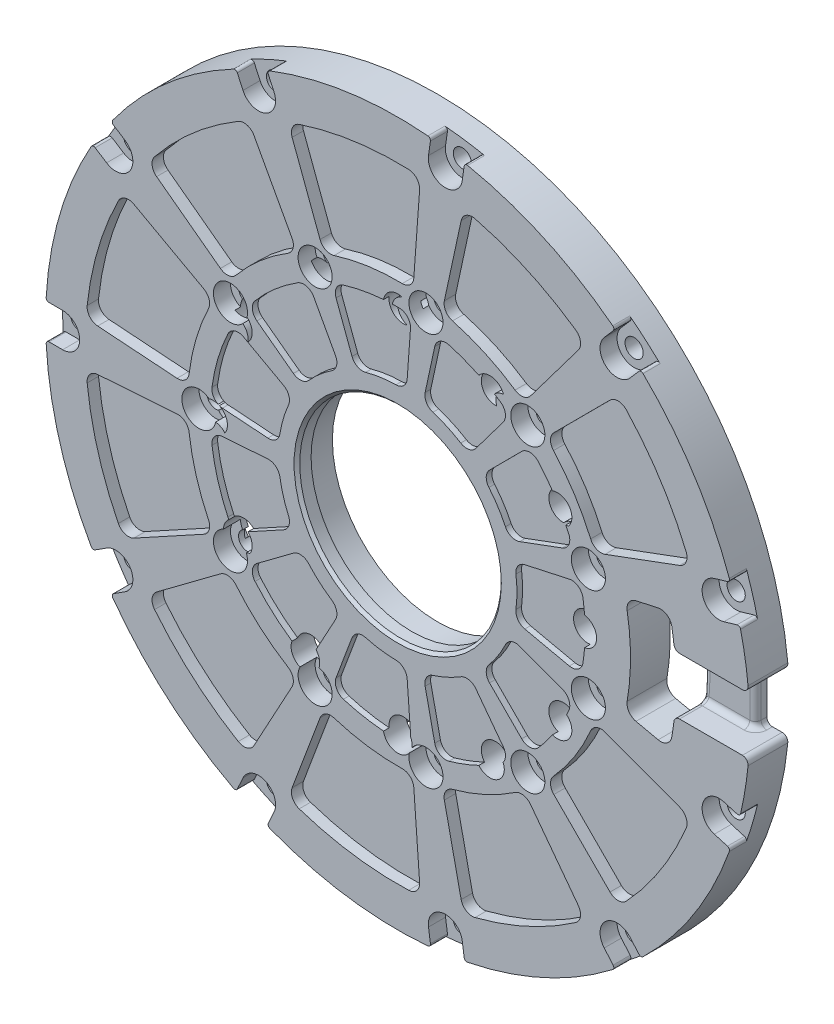
from build123d import *

# Parameters (mm, degrees)
SKETCH1_R           = 39.1
SKETCH1_R_2         = 2.5250000000000004
SKETCH1_R_3         = 2.524999999999999
SKETCH1_R_4         = 2.524999999999997
SKETCH1_R_5         = 2.5250000000000044
SKETCH1_R_6         = 2.525000000000001
SKETCH1_R_7         = 16
BOSS_EXTRUDE1_DEPTH = 7
SKETCH2_R           = 18.5
CUT_EXTRUDE1_DEPTH  = 4.5
SKETCH3_R           = 2.5500000000000007
SKETCH3_R_2         = 2.549999999999998
SKETCH3_R_3         = 2.5499999999999994
SKETCH3_R_4         = 2.5500000000000025
SKETCH3_R_5         = 2.549999999999999
SKETCH3_R_6         = 2.549999999999996
SKETCH3_R_7         = 2.55
BOSS_EXTRUDE2_DEPTH = 2
CHAMFER3_SIZE       = 0.5
SKETCH4_R           = 39.1
CUT_EXTRUDE2_DEPTH  = 3
SKETCH5_R           = 17.75
CUT_EXTRUDE3_DEPTH  = 10
CHAMFER5_SIZE       = 0.5
SKETCH7_R           = 1.5749999999999995
SKETCH7_R_2         = 1.5750000000000013
SKETCH7_R_3         = 1.574999999999998
SKETCH7_R_4         = 1.5749999999999964
SKETCH7_R_5         = 1.5750000000000004
CUT_EXTRUDE5_DEPTH  = 56.737061291388535
BOSS_EXTRUDE3_START = -7
SKETCH8_R           = 62
SKETCH8_R_2         = 39.1
BOSS_EXTRUDE3_DEPTH = 7
SKETCH9_R           = 40
SKETCH9_R_2         = 39.1
CUT_EXTRUDE6_DEPTH  = 3
SKETCH11_R          = 1.599999999999998
SKETCH11_R_2        = 1.5999999999999976
SKETCH11_R_3        = 1.5999999999999988
SKETCH11_R_4        = 1.5999999999999983
SKETCH11_R_5        = 1.5999999999999994
SKETCH11_R_6        = 1.5999999999999959
SKETCH11_R_7        = 1.5999999999999925
SKETCH11_R_8        = 1.6000000000000039
SKETCH11_R_9        = 1.6000000000000043
CUT_EXTRUDE7_DEPTH  = 88.96021828872415
CUT_EXTRUDE9_DEPTH  = 1
CUT_EXTRUDE10_DEPTH = 2
CUT_EXTRUDE11_DEPTH = 88.96021828872415
SKETCH15_W          = 13.794781450302672
SKETCH15_H          = 10
CUT_EXTRUDE14_DEPTH = 5
CUT_EXTRUDE15_DEPTH = 88.96021828872415
FILLET3_R           = 1
CUT_EXTRUDE16_DEPTH = 3
FILLET4_R           = 0.5
SKETCH18_R          = 3.0000000000000013
SKETCH18_R_2        = 3.000000000000005
SKETCH18_R_3        = 3.0000000000000018
SKETCH18_R_4        = 3.0000000000000036
SKETCH18_R_5        = 2.999999999999994
SKETCH18_R_6        = 3.000000000000004
SKETCH18_R_7        = 2.999999999999999
CUT_EXTRUDE17_DEPTH = 3


with BuildPart() as part:
    # Sketch1 → Boss-Extrude1 (new body)
    with BuildSketch(Plane.XY.offset(15)):
        Circle(SKETCH1_R)
        with Locations((32.5, 0)):
            Circle(SKETCH1_R_2, mode=Mode.SUBTRACT)
        with Locations((28.145825622994256, -16.249999999999996)):
            Circle(SKETCH1_R_2, mode=Mode.SUBTRACT)
        with Locations((16.250000000000004, -28.145825622994252)):
            Circle(SKETCH1_R_2, mode=Mode.SUBTRACT)
        with Locations((1.99e-15, -32.5)):
            Circle(SKETCH1_R_3, mode=Mode.SUBTRACT)
        with Locations((-16.249999999999993, -28.14582562299426)):
            Circle(SKETCH1_R_2, mode=Mode.SUBTRACT)
        with Locations((-28.145825622994252, -16.25000000000001)):
            Circle(SKETCH1_R_4, mode=Mode.SUBTRACT)
        with Locations((-32.5, -3.98e-15)):
            Circle(SKETCH1_R_5, mode=Mode.SUBTRACT)
        with Locations((-28.14582562299426, 16.24999999999999)):
            Circle(SKETCH1_R_2, mode=Mode.SUBTRACT)
        with Locations((-16.250000000000014, 28.145825622994252)):
            Circle(SKETCH1_R_4, mode=Mode.SUBTRACT)
        with Locations((-5.97e-15, 32.5)):
            Circle(SKETCH1_R_6, mode=Mode.SUBTRACT)
        with Locations((16.24999999999998, 28.145825622994266)):
            Circle(SKETCH1_R_4, mode=Mode.SUBTRACT)
        Circle(SKETCH1_R_7, mode=Mode.SUBTRACT)
        with Locations((28.145825622994256, 16.25)):
            Circle(SKETCH1_R_2, mode=Mode.SUBTRACT)
    extrude(amount=BOSS_EXTRUDE1_DEPTH)

    # Sketch2 → Cut-Extrude1 (cut)
    with BuildSketch(Plane(origin=(0, 0, 15), x_dir=(-1, 0, 0), z_dir=(0, 0, -1))):
        Circle(SKETCH2_R)
    extrude(amount=-CUT_EXTRUDE1_DEPTH, mode=Mode.SUBTRACT)

    # Sketch3 → Boss-Extrude2 (add)
    with BuildSketch(Plane.XY.offset(22)):
        with Locations((-16.250000000000014, 28.145825622994252)):
            Circle(SKETCH3_R)
        with Locations((1.5464122642716096, 32.46318852344777)):
            Circle(SKETCH3_R_2)
        with Locations((18.85184956106393, 26.473718441635924)):
            Circle(SKETCH3_R_3)
        with Locations((30.17195782302236, 12.079029808960666)):
            Circle(SKETCH3_R_4)
        with Locations((31.912682661037973, -6.150665441713317)):
            Circle(SKETCH3_R_5)
        with Locations((23.5213562384148, -22.427567873168638)):
            Circle(SKETCH3_R_6)
        with Locations((7.662165404056412, -31.583875970515102)):
            Circle(SKETCH3_R_3)
        with Locations((-10.629708807816185, -30.71252660822673)):
            Circle(SKETCH3_R)
        with Locations((-25.546725579140585, -20.090167052169683)):
            Circle(SKETCH3_R_3)
        with Locations((-32.35283748362525, -3.089321407385964)):
            Circle(SKETCH3_R_3)
        with Locations((-28.887152081285027, 14.892361956140828)):
            Circle(SKETCH3_R_7)
    extrude(amount=-BOSS_EXTRUDE2_DEPTH)

    # Chamfer3
    chamfer3_edges = [part.edges().sort_by_distance(p)[0] for p in [
        (29.975, 3.1e-16, 15),
        (25.620825622994253, -16.249999999999996, 15),
        (13.725000000000003, -28.145825622994252, 15),
        (-2.5249999999999972, -32.5, 15),
        (-18.77499999999999, -28.14582562299426, 15),
        (-30.67082562299425, -16.25000000000001, 15),
        (-35.025000000000006, -3.67e-15, 15),
        (-30.670825622994258, 16.24999999999999, 15),
        (-18.775000000000013, 28.145825622994252, 15),
        (-2.5250000000000066, 32.5, 15),
        (13.724999999999982, 28.145825622994266, 15),
    ]]
    chamfer(chamfer3_edges, length=CHAMFER3_SIZE)

    # Sketch4 → Cut-Extrude2 (cut)
    with BuildSketch(Plane(origin=(0, 0, 15), x_dir=(-1, 0, 0), z_dir=(0, 0, -1))):
        Circle(SKETCH4_R)
        with BuildLine():
            ThreePointArc((-6.4472908855823725, 32.31307692307692), (5.97e-15, 38.949999999999996), (6.447290885582385, 32.31307692307692))
            ThreePointArc((6.4472908855823805, 32.313076923076906), (9.283087747925112, 31.61529348059768), (12.045962087511466, 30.669158732939437))
            ThreePointArc((12.045962087511468, 30.669158732939447), (21.057959839895535, 32.7668251037745), (22.89357455688436, 23.697821503428884))
            ThreePointArc((22.89357455688436, 23.697821503428884), (24.90194847497281, 21.577661183497135), (26.714707210521354, 19.28799934301425))
            ThreePointArc((26.714707210521354, 19.28799934301425), (35.43016621905849, 16.180414756423474), (32.071310064643654, 7.558675197247654))
            ThreePointArc((32.07131006464366, 7.558675197247655), (32.61461650997674, 4.689273921104743), (32.90172155129198, 1.7830364441730298))
            ThreePointArc((32.90172155129197, 1.7830364441730282), (38.553545161262335, -5.5431629507444615), (31.06663123192701, -10.980297077012864))
            ThreePointArc((31.066631231927012, -10.98029707701286), (29.972374246931373, -13.68792467841216), (28.64267177198301, -16.288027927359646))
            ThreePointArc((28.642671771983007, -16.288027927359643), (29.436445921098354, -25.506825587168862), (20.19851648940056, -26.033102612393584))
            ThreePointArc((20.19851648940056, -26.033102612393584), (17.814114935161932, -27.719303906787424), (15.289776084517339, -29.187758517661507))
            ThreePointArc((15.289776084517337, -29.187758517661504), (10.973483088973685, -37.372251322284676), (2.917515477387173, -32.82058200945265))
            ThreePointArc((2.9175154773871737, -32.82058200945265), (-4.4e-16, -32.95), (-2.917515477387175, -32.82058200945265))
            ThreePointArc((-2.9175154773871714, -32.82058200945265), (-10.97348308897368, -37.372251322284676), (-15.289776084517333, -29.187758517661507))
            ThreePointArc((-15.28977608451734, -29.187758517661514), (-17.81411493516194, -27.719303906787424), (-20.198516489400568, -26.033102612393577))
            ThreePointArc((-20.19851648940056, -26.033102612393574), (-29.436445921098365, -25.506825587168862), (-28.64267177198301, -16.288027927359632))
            ThreePointArc((-28.642671771983018, -16.288027927359632), (-29.97237424693138, -13.687924678412156), (-31.066631231927012, -10.980297077012857))
            ThreePointArc((-31.066631231927012, -10.98029707701286), (-38.55354516126232, -5.543162950744453), (-32.90172155129197, 1.7830364441730326))
            ThreePointArc((-32.90172155129198, 1.7830364441730322), (-32.61461650997672, 4.689273921104741), (-32.07131006464364, 7.558675197247652))
            ThreePointArc((-32.07131006464364, 7.558675197247654), (-35.4301662190585, 16.180414756423467), (-26.71470721052136, 19.28799934301425))
            ThreePointArc((-26.714707210521368, 19.28799934301425), (-24.901948474972805, 21.577661183497142), (-22.89357455688436, 23.697821503428905))
            ThreePointArc((-22.89357455688435, 23.6978215034289), (-21.057959839895513, 32.766825103774515), (-12.04596208751145, 30.66915873293946))
            ThreePointArc((-12.045962087511453, 30.669158732939458), (-9.2830877479251, 31.615293480597693), (-6.447290885582371, 32.31307692307692))
        make_face(mode=Mode.SUBTRACT)
    extrude(amount=-CUT_EXTRUDE2_DEPTH, mode=Mode.SUBTRACT)

    # Sketch5 → Cut-Extrude3 (cut)
    with BuildSketch(Plane.XY.offset(22)):
        Circle(SKETCH5_R)
    extrude(amount=-CUT_EXTRUDE3_DEPTH, mode=Mode.SUBTRACT)

    # Chamfer5
    chamfer5_edges = [part.edges().sort_by_distance(p)[0] for p in [
        (-17.75, 2.17e-15, 22),
    ]]
    chamfer(chamfer5_edges, length=CHAMFER5_SIZE)

    # Sketch7 → Cut-Extrude5 (cut, through all)
    with BuildSketch(Plane.XY.offset(22)):
        with Locations((-35, -4.29e-15)):
            Circle(SKETCH7_R)
        with Locations((-29.443873649091348, 18.922428610945914)):
            Circle(SKETCH7_R)
        with Locations((-14.539525455066029, 31.83711983740814)):
            Circle(SKETCH7_R_2)
        with Locations((4.981019339564972, 34.64375046583265)):
            Circle(SKETCH7_R_3)
        with Locations((22.920125688084976, 26.451235102399046)):
            Circle(SKETCH7_R)
        with Locations((33.58225407650742, 9.860639489450046)):
            Circle(SKETCH7_R)
        with Locations((33.58225407650742, -9.860639489450026)):
            Circle(SKETCH7_R)
        with Locations((22.920125688084987, -26.451235102399032)):
            Circle(SKETCH7_R_4)
        with Locations((4.9810193395649875, -34.643750465832646)):
            Circle(SKETCH7_R_5)
        with Locations((-14.539525455066011, -31.837119837408153)):
            Circle(SKETCH7_R)
        with Locations((-29.443873649091337, -18.922428610945925)):
            Circle(SKETCH7_R_4)
    extrude(amount=-CUT_EXTRUDE5_DEPTH, mode=Mode.SUBTRACT)

    # Sketch8 → Boss-Extrude3 (add)
    with BuildSketch(Plane.XY.offset(22).offset(BOSS_EXTRUDE3_START)):
        Circle(SKETCH8_R)
        Circle(SKETCH8_R_2, mode=Mode.SUBTRACT)
    extrude(amount=BOSS_EXTRUDE3_DEPTH)

    # Sketch9 → Cut-Extrude6 (cut)
    with BuildSketch(Plane(origin=(0, 0, 15), x_dir=(-1, 0, 0), z_dir=(0, 0, -1))):
        Circle(SKETCH9_R)
        Circle(SKETCH9_R_2, mode=Mode.SUBTRACT)
    extrude(amount=-CUT_EXTRUDE6_DEPTH, mode=Mode.SUBTRACT)

    # Sketch11 → Cut-Extrude7 (cut, through all)
    with BuildSketch(Plane.XY.offset(22)):
        with Locations((-59, -7.23e-15)):
            Circle(SKETCH11_R)
        with Locations((-49.63395843703966, 31.897808229880315)):
            Circle(SKETCH11_R_2)
        with Locations((-24.509485767111165, 53.66828772591664)):
            Circle(SKETCH11_R_3)
        with Locations((8.39657545812404, 58.399465070975005)):
            Circle(SKETCH11_R_4)
        with Locations((38.63678330277205, 44.58922488690104)):
            Circle(SKETCH11_R_5)
        with Locations((56.610085443255464, 16.622220853643977)):
            Circle(SKETCH11_R_6)
        with Locations((56.6100854432552, -16.622220853644773)):
            Circle(SKETCH11_R_7)
        with Locations((38.63678330277142, -44.58922488690158)):
            Circle(SKETCH11_R_2)
        with Locations((8.39657545812322, -58.39946507097512)):
            Circle(SKETCH11_R_8)
        with Locations((-24.509485767111933, -53.66828772591628)):
            Circle(SKETCH11_R_3)
        with Locations((-49.63395843704012, -31.8978082298796)):
            Circle(SKETCH11_R_9)
    extrude(amount=-CUT_EXTRUDE7_DEPTH, mode=Mode.SUBTRACT)

    # Sketch12 → Cut-Extrude9 (cut)
    with BuildSketch(Plane.XY.offset(22)):
        with BuildLine():
            Line((-22.857063854411898, -1.5983216057281133), (-30.860059476495543, -2.1579455755782355))
            ThreePointArc((-30.860059476495543, -2.1579455755782346), (-32.271527779173944, -2.890355512123229), (-32.70251727281423, -4.42101391326549))
            ThreePointArc((-32.702517272814234, -4.421013913265491), (-31.66326812927847, -9.297174375766968), (-29.90128876427831, -13.961122097999288))
            ThreePointArc((-29.901288764278306, -13.961122097999285), (-28.71118092090148, -15.0157833733615), (-27.127807517987755, -14.868828442987942))
            Line((-27.127807517987755, -14.868828442987942), (-20.09270361714983, -11.012867989464588))
            ThreePointArc((-20.09270361714983, -11.012867989464588), (-19.160316095246387, -9.90247379693526), (-19.223204192706856, -8.453899725304158))
            ThreePointArc((-19.22320419270686, -8.453899725304158), (-20.149352445904487, -5.916383693669891), (-20.742111697625948, -3.2809758187479567))
            ThreePointArc((-20.742111697625948, -3.2809758187479563), (-21.472365133695913, -2.02835789100138), (-22.857063854411898, -1.5983216057281142))
        make_face()
        with BuildLine():
            Line((-20.09270361714969, 11.012867989464858), (-27.127807517987556, 14.868828442988303))
            ThreePointArc((-27.127807517987556, 14.868828442988303), (-28.711180920901278, 15.015783373361879), (-29.901288764278117, 13.961122097999683))
            ThreePointArc((-29.90128876427812, 13.961122097999684), (-31.663268129278354, 9.297174375767387), (-32.70251727281418, 4.421013913265924))
            ThreePointArc((-32.70251727281417, 4.421013913265927), (-32.27152777917391, 2.8903555121236604), (-30.86005947649552, 2.1579455755786467))
            Line((-30.86005947649552, 2.1579455755786467), (-22.85706385441187, 1.5983216057284217))
            ThreePointArc((-22.85706385441187, 1.5983216057284217), (-21.47236513369588, 2.02835789100167), (-20.7421116976259, 3.2809758187482365))
            ThreePointArc((-20.7421116976259, 3.2809758187482374), (-20.149352445904398, 5.9163836936701575), (-19.22320419270674, 8.45389972530441))
            ThreePointArc((-19.22320419270674, 8.45389972530441), (-19.16031609524626, 9.902473796935515), (-20.09270361714969, 11.012867989464858))
        make_face()
        with BuildLine():
            Line((-10.949051949702167, 20.127549811209594), (-14.78266834844707, 27.174854489027556))
            ThreePointArc((-14.78266834844707, 27.174854489027556), (-16.035236983752867, 28.154517134260022), (-17.606612345494316, 27.910700487724903))
            ThreePointArc((-17.606612345494316, 27.910700487724903), (-21.61040422019424, 24.93973595369067), (-25.12092761217698, 21.39950924446082))
            ThreePointArc((-25.12092761217698, 21.39950924446082), (-25.585892587277826, 19.878826944785715), (-24.794460597976695, 18.49958712121385))
            Line((-24.794460597976695, 18.49958712121385), (-18.364467818193926, 13.702055384303454))
            ThreePointArc((-18.364467818193926, 13.702055384303453), (-16.967089958679086, 13.315200280237558), (-15.675545295306671, 13.974164722615408))
            ThreePointArc((-15.675545295306673, 13.97416472261541), (-13.752075412850886, 15.870741061439514), (-11.601065181273494, 17.50472183897373))
            ThreePointArc((-11.601065181273492, 17.50472183897373), (-10.765002076880204, 18.689340021881783), (-10.949051949702167, 20.127549811209594))
        make_face()
        with BuildLine():
            Line((1.670846349471529, 22.85187678236643), (2.2558635723819913, 30.853056243147126))
            ThreePointArc((2.2558635723819904, 30.853056243147126), (1.7317813961666504, 32.35439063534265), (0.2780390906057538, 32.998828680183415))
            ThreePointArc((0.27803909060575366, 32.99882868018342), (-4.696389663018197, 32.66410758207083), (-9.563620930666346, 31.58381159224644))
            ThreePointArc((-9.563620930666344, 31.58381159224644), (-10.776917280199292, 30.55591127955765), (-10.856795668887317, 28.967740467700096))
            Line((-10.856795668887317, 28.967740467700096), (-8.041283006828484, 21.455483392459172))
            ThreePointArc((-8.041283006828484, 21.455483392459172), (-7.074883605510605, 20.374560661207507), (-5.632104019837971, 20.23065506378192))
            ThreePointArc((-5.632104019837972, 20.230655063781924), (-2.9886116037388533, 20.78625027949961), (-0.2956699439955266, 20.997918451223157))
            ThreePointArc((-0.2956699439955265, 20.997918451223153), (1.048124039025304, 21.54247284244696), (1.67084634947153, 22.85187678236643))
        make_face()
        with BuildLine():
            Line((13.760262738324187, 18.320894338767616), (18.57817474815012, 24.735630637345746))
            ThreePointArc((18.57817474815012, 24.735630637345746), (18.948971418985895, 26.281973714904154), (18.07441507996884, 27.610061925265494))
            ThreePointArc((18.074415079968844, 27.610061925265498), (13.708695429062459, 30.017855846699035), (9.03006782301441, 31.740476920042646))
            ThreePointArc((9.030067823014406, 31.740476920042642), (7.453653117283704, 31.531709680822317), (6.527825174621256, 30.238840891965108))
            Line((6.527825174621256, 30.238840891965108), (4.834952342214321, 22.396947020710574))
            ThreePointArc((4.834952342214321, 22.396947020710574), (5.063548303668689, 20.965141992010484), (6.199490487383894, 20.064055365175722))
            ThreePointArc((6.199490487383894, 20.064055365175726), (8.723715273039739, 19.102271902444826), (11.10359841139703, 17.824424319411307))
            ThreePointArc((11.103598411397028, 17.82442431941131), (12.528478178230861, 17.55602274737478), (13.760262738324187, 18.320894338767616))
        make_face()
        with BuildLine():
            Line((21.48089293312944, 7.973157391863654), (29.00204670849066, 10.764817077801492))
            ThreePointArc((29.00204670849066, 10.764817077801492), (30.149996903311276, 11.865215839536074), (30.13229198915617, 13.455295592451144))
            ThreePointArc((30.132291989156172, 13.455295592451144), (27.7613665834291, 17.841146976034537), (24.75677384629843, 21.81976509321845))
            ThreePointArc((24.75677384629843, 21.819765093218447), (23.317741315025426, 22.496413050840207), (21.839907648596224, 21.90932299047117))
            Line((21.839907648596224, 21.90932299047117), (16.176124484744868, 16.22753821915196))
            ThreePointArc((16.176124484744868, 16.22753821915196), (15.594339403755841, 14.89943887296482), (16.062790568367976, 13.527259853967063))
            ThreePointArc((16.06279056836798, 13.527259853967067), (17.666324189454883, 11.353457166567436), (18.97755272544841, 8.991801407550424))
            ThreePointArc((18.977552725448408, 8.991801407550424), (20.03112901784484, 7.995659474940262), (21.48089293312944, 7.973157391863653))
        make_face()
        with BuildLine():
            Line((22.3814913984028, -4.906000691318916), (30.21797375755527, -6.623749843381864))
            ThreePointArc((30.21797375755527, -6.623749843381862), (31.778611400533666, -6.318664229275723), (32.62337909638781, -4.971432020390791))
            ThreePointArc((32.62337909638781, -4.971432020390792), (33, -2.1161e-13), (32.62337909638788, 4.971432020390373))
            ThreePointArc((32.62337909638787, 4.971432020390374), (31.778611400533748, 6.318664229275321), (30.217973757555352, 6.623749843381479))
            Line((30.217973757555352, 6.623749843381479), (22.38149139840285, 4.906000691318633))
            ThreePointArc((22.38149139840285, 4.906000691318632), (21.1740379274875, 4.1032691861572985), (20.826268138149974, 2.6956549181746814))
            ThreePointArc((20.826268138149974, 2.6956549181746814), (21, -1.3212e-13), (20.82626813814994, -2.6956549181749434))
            ThreePointArc((20.82626813814994, -2.6956549181749425), (21.174037927487458, -4.103269186157565), (22.3814913984028, -4.906000691318917))
        make_face()
        with BuildLine():
            Line((16.176124484744662, -16.227538219152176), (21.839907648595936, -21.909322990471455))
            ThreePointArc((21.839907648595936, -21.909322990471455), (23.317741315025128, -22.496413050840513), (24.756773846298138, -21.81976509321877))
            ThreePointArc((24.756773846298138, -21.81976509321877), (27.761366583428867, -17.841146976034906), (30.13229198915598, -13.455295592451538))
            ThreePointArc((30.132291989155984, -13.455295592451538), (30.149996903311116, -11.86521583953647), (29.002046708490514, -10.764817077801872))
            Line((29.002046708490514, -10.764817077801872), (21.480892933129326, -7.97315739186393))
            ThreePointArc((21.480892933129326, -7.973157391863928), (20.03112901784473, -7.995659474940519), (18.977552725448295, -8.99180140755067))
            ThreePointArc((18.977552725448287, -8.991801407550668), (17.666324189454727, -11.353457166567656), (16.06279056836779, -13.527259853967264))
            ThreePointArc((16.062790568367795, -13.527259853967266), (15.594339403755647, -14.899438872965025), (16.176124484744662, -16.227538219152176))
        make_face()
        with BuildLine():
            Line((4.834952342214032, -22.39694702071064), (6.5278251746208555, -30.23884089196519))
            ThreePointArc((6.527825174620855, -30.23884089196519), (7.453653117283286, -31.531709680822413), (9.030067823013987, -31.74047692004276))
            ThreePointArc((9.030067823013987, -31.740476920042752), (13.70869542906205, -30.01785584669919), (18.074415079968468, -27.61006192526572))
            ThreePointArc((18.074415079968468, -27.610061925265725), (18.948971418985543, -26.2819737149044), (18.578174748149785, -24.73563063734599))
            Line((18.578174748149785, -24.73563063734599), (13.760262738323942, -18.320894338767786))
            ThreePointArc((13.760262738323942, -18.320894338767786), (12.528478178230628, -17.556022747374936), (11.103598411396797, -17.824424319411452))
            ThreePointArc((11.1035984113968, -17.82442431941145), (8.723715273039492, -19.10227190244494), (6.199490487383629, -20.064055365175804))
            ThreePointArc((6.199490487383629, -20.0640553651758), (5.063548303668415, -20.96514199201055), (4.834952342214032, -22.39694702071064))
        make_face()
        with BuildLine():
            Line((-8.041283006828756, -21.455483392459076), (-10.856795668887687, -28.967740467699958))
            ThreePointArc((-10.856795668887688, -28.967740467699958), (-10.776917280199688, -30.555911279557517), (-9.56362093066675, -31.583811592246317))
            ThreePointArc((-9.56362093066675, -31.583811592246317), (-4.696389663018612, -32.66410758207074), (0.27803909060532983, -32.99882868018341))
            ThreePointArc((0.2780390906053305, -32.99882868018341), (1.731781396166235, -32.35439063534267), (2.255863572381598, -30.853056243147158))
            Line((2.2558635723815974, -30.853056243147158), (1.670846349471241, -22.851876782366443))
            ThreePointArc((1.6708463494712407, -22.851876782366443), (1.048124039025033, -21.542472842446966), (-0.2956699439957913, -20.99791845122315))
            ThreePointArc((-0.29566994399579294, -20.997918451223157), (-2.9886116037391166, -20.786250279499576), (-5.632104019838228, -20.230655063781853))
            ThreePointArc((-5.632104019838226, -20.23065506378185), (-7.074883605510862, -20.374560661207425), (-8.041283006828756, -21.455483392459076))
        make_face()
        with BuildLine():
            Line((-18.364467818194118, -13.702055384303222), (-24.794460597976947, -18.49958712121352))
            ThreePointArc((-24.794460597976947, -18.49958712121352), (-25.58589258727809, -19.87882694478537), (-25.120927612177272, -21.39950924446048))
            ThreePointArc((-25.12092761217727, -21.399509244460482), (-21.610404220194575, -24.93973595369038), (-17.60661234549469, -27.910700487724675))
            ThreePointArc((-17.60661234549469, -27.91070048772467), (-16.035236983753247, -28.1545171342598), (-14.782668348447435, -27.17485448902736))
            Line((-14.782668348447437, -27.17485448902736), (-10.949051949702431, -20.12754981120944))
            ThreePointArc((-10.949051949702431, -20.12754981120944), (-10.765002076880453, -18.689340021881637), (-11.601065181273725, -17.50472183897358))
            ThreePointArc((-11.601065181273723, -17.50472183897358), (-13.752075412851093, -15.870741061439336), (-15.675545295306856, -13.974164722615201))
            ThreePointArc((-15.675545295306858, -13.974164722615201), (-16.96708995867927, -13.31520028023734), (-18.364467818194118, -13.702055384303222))
        make_face()
    extrude(amount=-CUT_EXTRUDE9_DEPTH, mode=Mode.SUBTRACT)

    # Sketch12<3> → Cut-Extrude10 (cut)
    with BuildSketch(Plane.XY.offset(22)):
        with BuildLine():
            Line((-38.853807151172234, -2.7169228659491633), (-52.833237326611496, -3.694459850904447))
            ThreePointArc((-52.833237326611496, -3.694459850904447), (-54.227636098339715, -4.406188232844417), (-54.68216680852415, -5.904289383553308))
            ThreePointArc((-54.68216680852415, -5.904289383553308), (-52.77211354879746, -15.495290626278281), (-49.19366584935388, -24.596407060831325))
            ThreePointArc((-49.19366584935388, -24.59640706083132), (-48.00135565288056, -25.61095209169087), (-46.44352334577036, -25.45582721560788))
            Line((-46.44352334577036, -25.455827215607883), (-34.15478192907586, -18.720333100061882))
            ThreePointArc((-34.15478192907586, -18.720333100061882), (-33.21119240172892, -17.57597721694452), (-33.31524006881569, -16.096421315223353))
            ThreePointArc((-33.31524006881569, -16.096421315223356), (-35.50124002373648, -10.424104603132658), (-36.72894578298225, -4.47040732716272))
            ThreePointArc((-36.72894578298225, -4.47040732716272), (-37.441323627640436, -3.169473282030421), (-38.853807151172234, -2.7169228659491624))
        make_face()
        with BuildLine():
            Line((-34.15478192907561, 18.720333100062344), (-46.44352334577002, 25.455827215608505))
            ThreePointArc((-46.44352334577002, 25.455827215608505), (-48.00135565288022, 25.610952091691516), (-49.193665849353565, 24.596407060831982))
            ThreePointArc((-49.193665849353565, 24.596407060831986), (-52.772113548797265, 15.495290626278985), (-54.68216680852406, 5.904289383554033))
            ThreePointArc((-54.68216680852406, 5.904289383554035), (-54.22763609833966, 4.4061882328451425), (-52.83323732661145, 3.6944598509051567))
            Line((-52.83323732661145, 3.694459850905156), (-38.85380715117219, 2.716922865949696))
            ThreePointArc((-38.85380715117219, 2.716922865949696), (-37.44132362764039, 3.169473282030932), (-36.72894578298219, 4.470407327163223))
            ThreePointArc((-36.72894578298219, 4.4704073271632225), (-35.50124002373633, 10.424104603133141), (-33.31524006881548, 16.09642131522381))
            ThreePointArc((-33.31524006881548, 16.09642131522381), (-33.211192401728695, 17.57597721694497), (-34.15478192907561, 18.720333100062344))
        make_face()
        with BuildLine():
            Line((-18.611854770654656, 34.214015578357056), (-25.308318856901437, 46.524069003446016))
            ThreePointArc((-25.308318856901437, 46.524069003446016), (-26.53498394900323, 47.49679608545564), (-28.086523568846477, 47.28791805331073))
            ThreePointArc((-28.08652356884648, 47.28791805331073), (-36.01734036699041, 41.56622658948445), (-42.809466171715755, 34.53041566637626))
            ThreePointArc((-42.809466171715755, 34.53041566637626), (-43.237025236743285, 33.024394926091176), (-42.44877175806986, 31.67178201856173))
            Line((-42.44877175806986, 31.671782018561725), (-31.217023130654173, 23.29157501888187))
            ThreePointArc((-31.217023130654173, 23.29157501888187), (-29.784099149527176, 22.908638408389628), (-28.481470725381662, 23.617913229564266))
            ThreePointArc((-28.481470725381666, 23.617913229564273), (-24.229847155975353, 27.962734251107722), (-19.324181027037643, 31.552749921905047))
            ThreePointArc((-19.32418102703764, 31.552749921905043), (-18.436742247340245, 32.74117913546104), (-18.611854770654656, 34.214015578357056))
        make_face()
        with BuildLine():
            Line((2.8402047723674033, 38.84498985520553), (3.862098048997344, 52.821247606052715))
            ThreePointArc((3.862098048997346, 52.821247606052715), (3.356057671444913, 54.302742918412044), (1.9378914948768875, 54.96584918432612))
            ThreePointArc((1.9378914948768877, 54.96584918432611), (-7.827316105030327, 54.44017930345134), (-17.34506250262159, 52.19337895538236))
            ThreePointArc((-17.345062502621595, 52.19337895538236), (-18.51896436070282, 51.15758956952754), (-18.58712108503004, 49.5935371774431))
            Line((-18.58712108503004, 49.5935371774431), (-13.669054835098853, 36.471316673724026))
            ThreePointArc((-13.669054835098851, 36.471316673724026), (-12.670633635827443, 35.37447270478881), (-11.191329952928191, 35.26689855777924))
            ThreePointArc((-11.191329952928193, 35.26689855777925), (-5.265649016111308, 36.62339334959455), (0.8021689526860817, 36.991303369458976))
            ThreePointArc((0.8021689526860817, 36.991303369458976), (2.1912433027829317, 37.51128801658534), (2.8402047723674024, 38.84498985520553))
        make_face()
        with BuildLine():
            Line((23.39051936809078, 31.14295431860905), (31.806326112620305, 42.34805331083883))
            ThreePointArc((31.806326112620305, 42.34805331083883), (32.181574693979684, 43.86795255961943), (31.347039701463853, 45.192511569449756))
            ThreePointArc((31.347039701463856, 45.19251156944976), (22.847825715104094, 50.029759744498364), (13.626275956699642, 53.2853132068478))
            ThreePointArc((13.626275956699642, 53.2853132068478), (12.07873685111134, 53.04861098689408), (11.175809202184954, 51.769694693675355))
            Line((11.175809202184952, 51.769694693675355), (8.218741789674079, 38.07167297866834))
            ThreePointArc((8.21874178967408, 38.07167297866834), (8.465668530828315, 36.60916186149792), (9.651979005421152, 35.71889277789709))
            ThreePointArc((9.651979005421149, 35.71889277789709), (15.370355481070026, 33.65638382811707), (20.673835957786963, 30.685379365269622))
            ThreePointArc((20.673835957786956, 30.685379365269625), (22.123524586857872, 30.371827994539707), (23.39051936809078, 31.14295431860905))
        make_face()
        with BuildLine():
            Line((36.51450933395767, 13.553250831454363), (49.65227036824761, 18.42965130648))
            ThreePointArc((49.65227036824761, 18.42965130648), (50.78966913531697, 19.50539721928896), (50.80372429043463, 21.070870846301144))
            ThreePointArc((50.80372429043464, 21.070870846301144), (46.26894430571517, 29.735244960057564), (40.27136807843391, 37.459537011171065))
            ThreePointArc((40.2713680784339, 37.45953701117106), (38.84152445697401, 38.09707323949577), (37.39049903220067, 37.509339931848984))
            Line((37.39049903220067, 37.509339931848984), (27.497145967080016, 27.584542114472278))
            ThreePointArc((27.497145967080016, 27.584542114472278), (26.914180754501597, 26.220700795158507), (27.43085282717406, 24.83039091866893))
            ThreePointArc((27.430852827174064, 24.830390918668925), (31.12638071475385, 20.0037102458569), (33.98170612063509, 14.637064225137234))
            ThreePointArc((33.98170612063509, 14.637064225137236), (35.03174313196044, 13.589527181309643), (36.51450933395767, 13.55325083145436))
        make_face()
        with BuildLine():
            Line((27.49714596707965, -27.584542114472647), (37.390499032200175, -37.50933993184947))
            ThreePointArc((37.390499032200175, -37.50933993184947), (38.8415244569735, -38.097073239496275), (40.271368078433426, -37.4595370111716))
            ThreePointArc((40.271368078433426, -37.4595370111716), (46.26894430571477, -29.73524496005816), (50.80372429043433, -21.07087084630181))
            ThreePointArc((50.803724290434324, -21.0708708463018), (50.78966913531671, -19.50539721928962), (49.652270368247365, -18.429651306480654))
            Line((49.652270368247365, -18.429651306480654), (36.51450933395748, -13.55325083145485))
            ThreePointArc((36.51450933395748, -13.55325083145485), (35.03174313196024, -13.589527181310109), (33.981706120634875, -14.63706422513769))
            ThreePointArc((33.981706120634875, -14.637064225137687), (31.12638071475357, -20.003710245857313), (27.430852827173727, -24.830390918669302))
            ThreePointArc((27.43085282717373, -24.830390918669302), (26.914180754501245, -26.22070079515887), (27.497145967079653, -27.584542114472647))
        make_face()
        with BuildLine():
            Line((8.218741789673565, -38.071672978668445), (11.175809202184267, -51.7696946936755))
            ThreePointArc((11.175809202184263, -51.7696946936755), (12.07873685111064, -53.04861098689423), (13.626275956698938, -53.28531320684798))
            ThreePointArc((13.626275956698942, -53.28531320684799), (22.847825715103426, -50.02975974449865), (31.347039701463252, -45.19251156945016))
            ThreePointArc((31.347039701463242, -45.19251156945016), (32.18157469397909, -43.86795255961985), (31.806326112619736, -42.34805331083925))
            Line((31.806326112619736, -42.34805331083925), (23.39051936809036, -31.14295431860936))
            ThreePointArc((23.39051936809036, -31.14295431860936), (22.12352458685746, -30.37182799454), (20.67383595778654, -30.6853793652699))
            ThreePointArc((20.673835957786544, -30.685379365269903), (15.370355481069572, -33.65638382811728), (9.651979005420673, -35.718892777897224))
            ThreePointArc((9.651979005420673, -35.718892777897224), (8.465668530827818, -36.60916186149802), (8.218741789673564, -38.071672978668445))
        make_face()
        with BuildLine():
            Line((-13.66905483509933, -36.47131667372385), (-18.587121085030674, -49.59353717744287))
            ThreePointArc((-18.587121085030674, -49.59353717744287), (-18.51896436070347, -51.1575895695273), (-17.345062502622262, -52.193378955382144))
            ThreePointArc((-17.345062502622266, -52.193378955382144), (-7.827316105031024, -54.440179303451245), (1.9378914948761852, -54.96584918432613))
            ThreePointArc((1.9378914948761825, -54.965849184326125), (3.3560576714442116, -54.302742918412086), (3.8620980489966614, -52.82124760605277))
            Line((3.862098048996663, -52.82124760605277), (2.8402047723668984, -38.84498985520557))
            ThreePointArc((2.8402047723668997, -38.84498985520557), (2.1912433027824405, -37.51128801658537), (0.8021689526855988, -36.991303369458976))
            ThreePointArc((0.8021689526855993, -36.991303369458976), (-5.2656490161117855, -36.623393349594465), (-11.191329952928657, -35.2668985577791))
            ThreePointArc((-11.191329952928657, -35.2668985577791), (-12.670633635827906, -35.374472704788644), (-13.669054835099328, -36.47131667372385))
        make_face()
        with BuildLine():
            Line((-31.21702313065449, -23.291575018881446), (-42.448771758070286, -31.67178201856115))
            ThreePointArc((-42.448771758070286, -31.671782018561146), (-43.23702523674374, -33.0243949260906), (-42.80946617171624, -34.5304156663757))
            ThreePointArc((-42.80946617171624, -34.5304156663757), (-36.017340366990965, -41.56622658948397), (-28.086523568847102, -47.28791805331035))
            ThreePointArc((-28.08652356884711, -47.28791805331036), (-26.534983949003866, -47.49679608545528), (-25.308318856902062, -46.524069003445675))
            Line((-25.308318856902062, -46.524069003445675), (-18.61185477065512, -34.21401557835681))
            ThreePointArc((-18.611854770655118, -34.21401557835681), (-18.436742247340685, -32.74117913546079), (-19.324181027038073, -31.552749921904777))
            ThreePointArc((-19.324181027038073, -31.55274992190478), (-24.22984715597574, -27.962734251107396), (-28.481470725381996, -23.61791322956389))
            ThreePointArc((-28.481470725381996, -23.617913229563886), (-29.78409914952749, -22.908638408389233), (-31.21702313065449, -23.291575018881446))
        make_face()
    extrude(amount=-CUT_EXTRUDE10_DEPTH, mode=Mode.SUBTRACT)

    # Sketch13 → Cut-Extrude11 (cut, through all)
    with BuildSketch(Plane.XY.offset(22)):
        with BuildLine():
            Line((45.8684080856364, 10.054309508341458), (41.957302220799896, 9.196998986216107))
            ThreePointArc((41.957302220799896, 9.196998986216107), (40.72685900091166, 8.360879606829334), (40.414112926200765, 6.906480752763513))
            ThreePointArc((40.414112926200765, 6.906480752763513), (41.00000000000001, -2.8449e-13), (40.41411292620066, -6.9064807527640735))
            ThreePointArc((40.41411292620066, -6.9064807527640735), (40.72685900091155, -8.360879606829902), (41.957302220799775, -9.196998986216693))
            Line((41.957302220799775, -9.196998986216693), (45.86840808563627, -10.0543095083421))
            ThreePointArc((45.86840808563627, -10.0543095083421), (47.4108479565931, -9.761577555338379), (48.266708675641574, -8.445403105876409))
            ThreePointArc((48.266708675641574, -8.445403105876409), (49.00000000000001, -3.4137e-13), (48.266708675641695, 8.445403105875737))
            ThreePointArc((48.266708675641695, 8.445403105875737), (47.41084795659323, 9.761577555337714), (45.8684080856364, 10.054309508341458))
        make_face()
    extrude(amount=-CUT_EXTRUDE11_DEPTH, mode=Mode.SUBTRACT)

    # Sketch15 → Cut-Extrude14 (cut)
    with BuildSketch(Plane.XY.offset(22)):
        with Locations((55.102609274848675, 0)):
            Rectangle(SKETCH15_W, SKETCH15_H)
    extrude(amount=-CUT_EXTRUDE14_DEPTH, mode=Mode.SUBTRACT)

    # Sketch16 → Cut-Extrude15 (cut, through all)
    with BuildSketch(Plane.XY.offset(22)):
        Polygon((62, -5), (57.99999999999999, -5.000000000000001), (57.99999999999999, 5), (62, 5), align=None)
    extrude(amount=-CUT_EXTRUDE15_DEPTH, mode=Mode.SUBTRACT)

    # Fillet3
    fillet3_edges = [part.edges().sort_by_distance(p)[0] for p in [
        (57.99999999999999, -5.000000000000001, 16),
        (48.744230427815765, -5, 19.5),
        (48.744230427815765, 5, 19.5),
        (57.99999999999999, 5, 16),
        (53.37211521390788, -5, 17),
        (49.000000000000014, -2.66e-15, 17),
        (53.37211521390788, 5, 17),
        (57.99999999999999, 0, 17),
        (61.79805822192141, -5.000000000000586, 18.5),
        (61.798058221921416, 5.000000000000567, 18.5),
    ]]
    fillet(fillet3_edges, radius=FILLET3_R)

    # Sketch17 → Cut-Extrude16 (cut)
    with BuildSketch(Plane.XY.offset(22)):
        with BuildLine():
            Line((-59, 2.999999999999979), (-61.84511051910877, 2.999999999999979))
            Line((-61.84511051910877, 2.999999999999979), (-62.99177762060307, 2.999999999999979))
            Line((-62.99177762060307, 2.999999999999979), (-62.99177762060307, -2.999999999999994))
            Line((-62.99177762060307, -2.999999999999994), (-61.84511051910877, -2.999999999999994))
            Line((-61.84511051910877, -2.999999999999994), (-59, -2.999999999999994))
            ThreePointArc((-59, -2.999999999999994), (-56.000000000000014, -7.23e-15), (-59, 2.999999999999979))
        make_face()
        with BuildLine():
            Line((-50.40549526017013, 35.95975170517692), (-51.3701330102835, 36.579686744278234))
            Line((-51.3701330102835, 36.579686744278234), (-54.613977915017074, 31.532165547291157))
            Line((-54.613977915017074, 31.532165547291157), (-53.64934016490371, 30.912230508189847))
            Line((-53.64934016490371, 30.912230508189847), (-51.2558808894083, 29.374047631387356))
            ThreePointArc((-51.2558808894083, 29.374047631387356), (-47.110197838548, 30.275885777514098), (-48.01203598467472, 34.42156882837443))
            Line((-48.01203598467472, 34.42156882837443), (-50.40549526017013, 35.95975170517692))
        make_face()
        with BuildLine():
            Line((-22.962491404338135, 57.502536323425446), (-23.438834133214222, 58.545581406965084))
            Line((-23.438834133214222, 58.545581406965084), (-28.89662610534132, 56.05309132895377))
            Line((-28.89662610534132, 56.05309132895377), (-28.420283376465232, 55.010046245414124))
            Line((-28.420283376465232, 55.010046245414124), (-27.238381753177855, 52.42204268691309))
            ThreePointArc((-27.238381753177855, 52.42204268691309), (-23.263240728108656, 50.9393917398552), (-21.780589781050757, 54.9145327649244))
            Line((-21.780589781050757, 54.9145327649244), (-22.962491404338135, 57.502536323425446))
        make_face()
        with BuildLine():
            Line((11.770941227160012, 60.78867195249412), (11.93412897026247, 61.92366763625264))
            Line((11.93412897026247, 61.92366763625264), (5.9952003189768845, 62.777556665892355))
            Line((5.9952003189768845, 62.777556665892355), (5.832012575874429, 61.64256098213382))
            Line((5.832012575874429, 61.64256098213382), (5.42711113247784, 58.82640958579897))
            ThreePointArc((5.42711113247784, 58.82640958579897), (7.969630943300775, 55.430000745336336), (11.366039783763425, 57.97252055615927))
            Line((11.366039783763425, 57.97252055615927), (11.770941227160012, 60.78867195249412))
        make_face()
        with BuildLine():
            Line((42.76718318853133, 44.77483374887847), (43.51809044820679, 45.64142692275882))
            Line((43.51809044820679, 45.64142692275882), (38.98359300208125, 49.57059132643052))
            Line((38.98359300208125, 49.57059132643052), (38.232685742405785, 48.70399815255017))
            Line((38.232685742405785, 48.70399815255017), (36.36953457970676, 46.5538070887429))
            ThreePointArc((36.36953457970676, 46.5538070887429), (36.67220110093368, 42.32197616384429), (40.9040320258323, 42.6246426850712))
            Line((40.9040320258323, 42.6246426850712), (42.76718318853133, 44.77483374887847))
        make_face()
        with BuildLine():
            Line((60.185146666020586, 14.545302193852589), (61.28536569297927, 14.868355648202527))
            Line((61.28536569297927, 14.868355648202527), (59.5949703519307, 20.625313489889503))
            Line((59.5949703519307, 20.625313489889503), (58.494751324972015, 20.30226003553956))
            Line((58.494751324972015, 20.30226003553956), (55.76488777273045, 19.500699774494596))
            ThreePointArc((55.76488777273045, 19.500699774494596), (53.73160652241126, 15.77702318312683), (57.455283113779025, 13.743741932807625))
            Line((57.455283113779025, 13.743741932807625), (60.185146666020586, 14.545302193852589))
        make_face()
        with BuildLine():
            Line((58.49475132497394, -20.30226003552612), (59.59497035193262, -20.625313489876063))
            Line((59.59497035193262, -20.625313489876063), (61.2853656929812, -14.868355648189093))
            Line((61.2853656929812, -14.868355648189093), (60.18514666602252, -14.545302193839152))
            Line((60.18514666602252, -14.545302193839152), (57.45528311378095, -13.743741932794189))
            ThreePointArc((57.45528311378095, -13.743741932794189), (53.73160652241319, -15.777023183113382), (55.76488777273238, -19.50069977448116))
            Line((55.76488777273238, -19.50069977448116), (58.49475132497394, -20.30226003552612))
        make_face()
        with BuildLine():
            Line((38.232685742410965, -48.70399815253884), (38.98359300208642, -49.570591326419176))
            Line((38.98359300208642, -49.570591326419176), (43.51809044821197, -45.64142692274747))
            Line((43.51809044821197, -45.64142692274747), (42.76718318853651, -44.77483374886713))
            Line((42.76718318853651, -44.77483374886713), (40.90403202583748, -42.62464268505985))
            ThreePointArc((40.90403202583748, -42.62464268505985), (36.67220110093887, -42.32197616383293), (36.36953457971193, -46.55380708873155))
            Line((36.36953457971193, -46.55380708873155), (38.232685742410965, -48.70399815253884))
        make_face()
        with BuildLine():
            Line((5.832012575881219, -61.64256098212601), (5.995200318983675, -62.77755666588451))
            Line((5.995200318983675, -62.77755666588451), (11.93412897026926, -61.92366763624481))
            Line((11.93412897026926, -61.92366763624481), (11.770941227166803, -60.7886719524863))
            Line((11.770941227166803, -60.7886719524863), (11.366039783770216, -57.97252055615144))
            ThreePointArc((11.366039783770216, -57.97252055615144), (7.969630943307574, -55.4300007453285), (5.42711113248463, -58.82640958579115))
            Line((5.42711113248463, -58.82640958579115), (5.832012575881219, -61.64256098212601))
        make_face()
        with BuildLine():
            Line((-28.42028337645898, -55.01004624541014), (-28.89662610533507, -56.053091328949776))
            Line((-28.89662610533507, -56.053091328949776), (-23.438834133207973, -58.54558140696109))
            Line((-23.438834133207973, -58.54558140696109), (-22.96249140433188, -57.50253632342145))
            Line((-22.96249140433188, -57.50253632342145), (-21.780589781044505, -54.91453276492041))
            ThreePointArc((-21.780589781044505, -54.91453276492041), (-23.263240728102396, -50.9393917398512), (-27.23838175317161, -52.422042686909094))
            Line((-27.23838175317161, -52.422042686909094), (-28.42028337645898, -55.01004624541014))
        make_face()
        with BuildLine():
            Line((-53.64934016490001, -30.91223050818876), (-54.613977915013386, -31.532165547290074))
            Line((-54.613977915013386, -31.532165547290074), (-51.37013301027981, -36.579686744277154))
            Line((-51.37013301027981, -36.579686744277154), (-50.40549526016644, -35.95975170517584))
            Line((-50.40549526016644, -35.95975170517584), (-48.01203598467103, -34.421568828373346))
            ThreePointArc((-48.01203598467103, -34.421568828373346), (-47.11019783854427, -30.275885777513043), (-51.2558808894046, -29.37404763138627))
            Line((-51.2558808894046, -29.37404763138627), (-53.64934016490001, -30.91223050818876))
        make_face()
    extrude(amount=-CUT_EXTRUDE16_DEPTH, mode=Mode.SUBTRACT)

    # Fillet4
    fillet4_edges = [part.edges().sort_by_distance(p)[0] for p in [
        (-53.71854698247565, 30.956707029197343, 20.5),
        (-50.4747020777421, 36.00422822618444, 20.5),
        (-28.45445803356798, 55.084878306264045, 20.5),
        (-22.996666061440955, 57.57736838427552, 20.5),
        (11.782648942688803, 60.87010090260534, 20.5),
        (5.843720291403169, 61.72398993224468, 20.5),
        (38.286558713608606, 48.76617087561213, 20.5),
        (42.8210561597345, 44.83700647194084, 20.5),
        (60.2640806051908, 14.56847928958495, 20.5),
        (58.57368526414161, 20.32543713127174, 20.5),
        (58.57368526414602, -20.32543713125903, 20.5),
        (60.264080605193975, -14.568479289571878, 20.5),
        (38.28655871361754, -48.76617087560512, 20.5),
        (42.8210561597427, -44.837006471932995, 20.5),
        (11.782648942696508, -60.87010090260384, 20.5),
        (5.843720291410978, -61.723989932243946, 20.5),
        (-28.45445803356439, -55.0848783062659, 20.5),
        (-22.996666061437203, -57.577368384277015, 20.5),
        (-53.71854698247511, -30.95670702919828, 20.5),
        (-50.47470207774149, -36.00422822618533, 20.5),
        (-61.927376821564145, -2.999999999999994, 20.5),
        (-61.927376821564145, 2.999999999999979, 20.5),
    ]]
    fillet(fillet4_edges, radius=FILLET4_R)

    # Sketch18 → Cut-Extrude17 (cut)
    with BuildSketch(Plane.XY.offset(22)):
        with Locations((-35, -4.29e-15)):
            Circle(SKETCH18_R)
        with Locations((-29.443873649091348, 18.922428610945914)):
            Circle(SKETCH18_R_2)
        with Locations((-14.539525455066029, 31.83711983740814)):
            Circle(SKETCH18_R_3)
        with Locations((4.981019339564972, 34.64375046583265)):
            Circle(SKETCH18_R_4)
        with Locations((22.920125688084976, 26.451235102399046)):
            Circle(SKETCH18_R_2)
        with Locations((33.58225407650742, 9.860639489450046)):
            Circle(SKETCH18_R)
        with Locations((33.58225407650742, -9.860639489450026)):
            Circle(SKETCH18_R_5)
        with Locations((22.920125688084987, -26.451235102399032)):
            Circle(SKETCH18_R_2)
        with Locations((4.9810193395649875, -34.643750465832646)):
            Circle(SKETCH18_R_6)
        with Locations((-14.539525455066011, -31.837119837408153)):
            Circle(SKETCH18_R_7)
        with Locations((-29.443873649091337, -18.922428610945925)):
            Circle(SKETCH18_R_2)
    extrude(amount=-CUT_EXTRUDE17_DEPTH, mode=Mode.SUBTRACT)


solid = part.part
